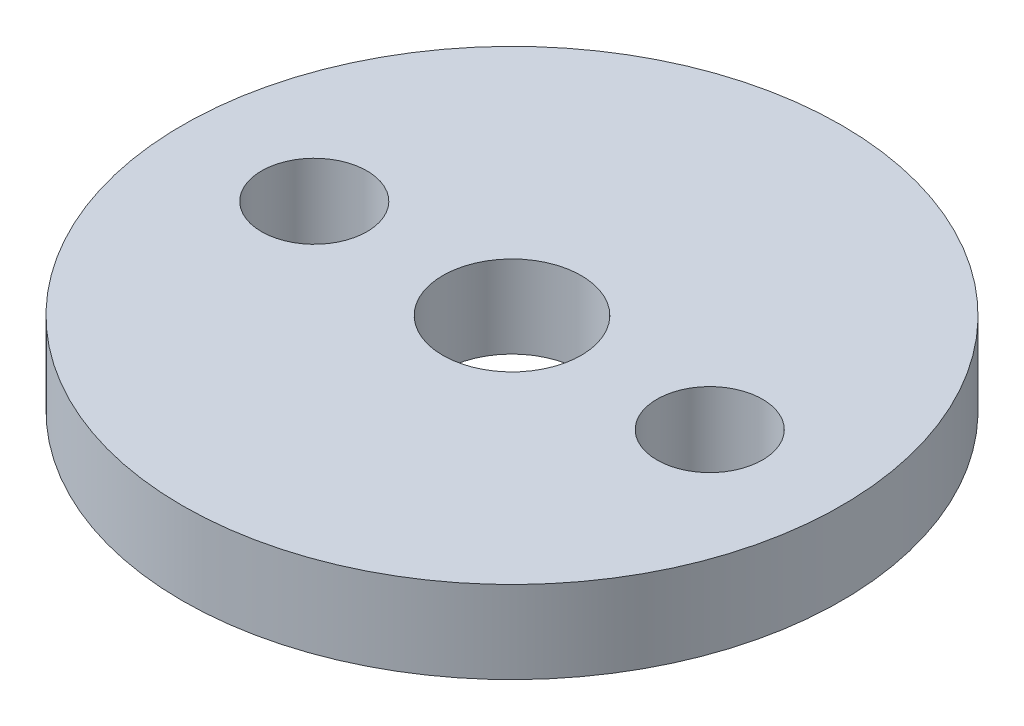
from build123d import *

# Parameters (mm, degrees)
SKETCH1_R               = 10
BOSS_EXTRUDE1_DEPTH     = 2.5
CUT_EXTRUDE1_DEPTH      = 15.361406616
CUT_EXTRUDE1_DEPTH_BACK = 15.361406616
SKETCH2_R               = 2.1
SKETCH2_R_2             = 1.6


with BuildPart() as part:
    # Sketch1 → Boss-Extrude1 (new body)
    with BuildSketch(Plane(origin=(0, 0, 0), x_dir=(1, 0, 0), z_dir=(0, 1, 0))):
        Circle(SKETCH1_R)
    extrude(amount=BOSS_EXTRUDE1_DEPTH)

    # Sketch2 → Cut-Extrude1 (cut, two sides: drawn at the far end of the back side and taken through both)
    with BuildSketch(Plane(origin=(0, 0, 0), x_dir=(1, 0, 0), z_dir=(0, 1, 0)).offset(-CUT_EXTRUDE1_DEPTH_BACK)):
        Circle(SKETCH2_R)
        with Locations((6, 0)):
            Circle(SKETCH2_R_2)
        with Locations((-6, 0)):
            Circle(SKETCH2_R_2)
    extrude(amount=CUT_EXTRUDE1_DEPTH + CUT_EXTRUDE1_DEPTH_BACK, mode=Mode.SUBTRACT)


solid = part.part
